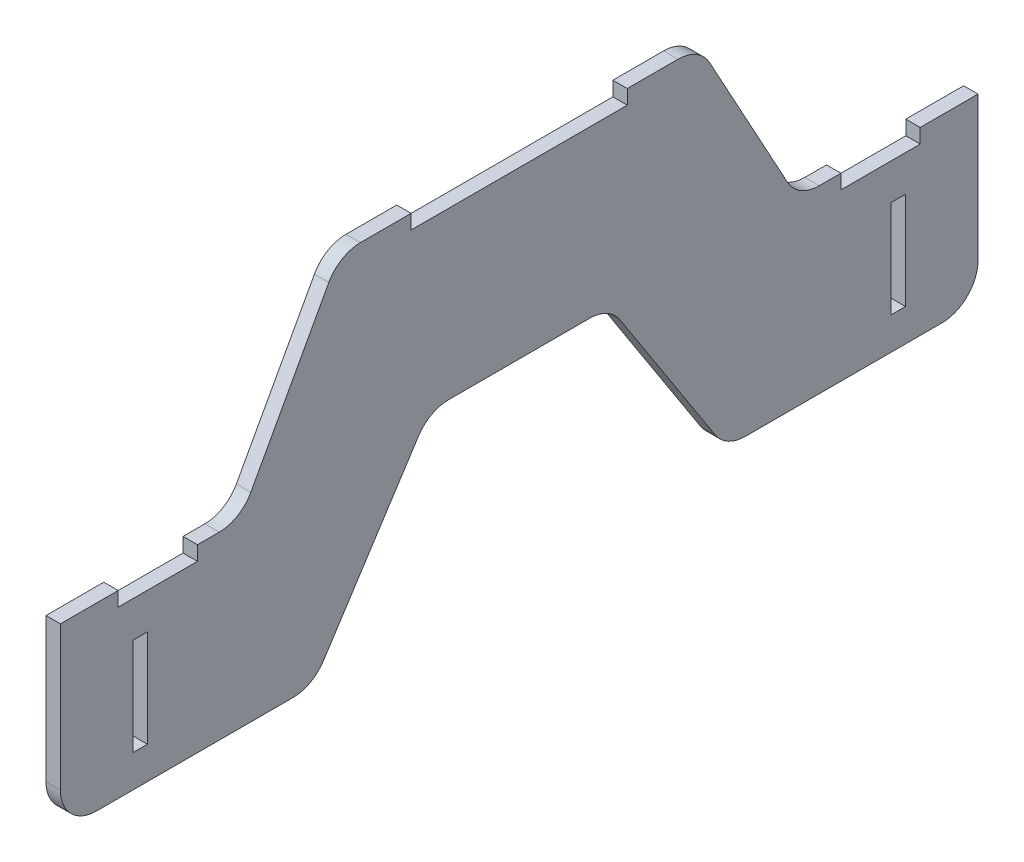
from build123d import *

# Parameters (mm, degrees)
SKETCH2_W           = 4
SKETCH2_H           = 27
BOSS_EXTRUDE1_DEPTH = 4


with BuildPart() as part:
    # Sketch2 → Boss-Extrude1 (new body)
    with BuildSketch(Plane(origin=(0, 0, 0), x_dir=(0, 0, -1), z_dir=(1, 0, 0))):
        with BuildLine():
            Line((10, -139.70232204), (64.557762355, -139.70232204))
            ThreePointArc((64.557762355, -139.70232204), (69.3379498, -138.485818382), (72.955114142, -135.132283638))
            Line((72.955114142, -135.132283638), (99.376278754, -94.272360441))
            ThreePointArc((99.376278754, -94.272360441), (102.993443097, -90.918825697), (107.773630541, -89.70232204))
            Line((107.773630541, -89.70232204), (146.889155251, -89.70232204))
            ThreePointArc((146.889155251, -89.70232204), (151.669342696, -90.918825697), (155.286507039, -94.272360441))
            Line((155.286507039, -94.272360441), (181.70767165, -135.132283638))
            ThreePointArc((181.70767165, -135.132283638), (185.324835993, -138.485818382), (190.105023438, -139.70232204))
            Line((190.105023438, -139.70232204), (244.662785793, -139.70232204))
            ThreePointArc((244.662785793, -139.70232204), (251.733853605, -136.773389851), (254.662785793, -129.70232204))
            Line((254.662785793, -129.70232204), (254.662785793, -100.70232204))
            Line((254.662785793, -100.70232204), (254.662785793, -89.70232204))
            Line((254.662785793, -89.70232204), (244.662785793, -89.70232204))
            Line((244.662785793, -89.70232204), (238.627896267, -89.70232204))
            Line((238.627896267, -89.70232204), (238.627896267, -93.70232204))
            Line((238.627896267, -93.70232204), (216.627896267, -93.70232204))
            Line((216.627896267, -93.70232204), (216.627896267, -89.70232204))
            Line((216.627896267, -89.70232204), (210.593006742, -89.70232204))
            ThreePointArc((210.593006742, -89.70232204), (205.492248957, -88.303616711), (201.818382591, -84.498776043))
            Line((201.818382591, -84.498776043), (180.175796098, -44.905868036))
            ThreePointArc((180.175796098, -44.905868036), (176.501929732, -41.101027368), (171.401171947, -39.70232204))
            Line((171.401171947, -39.70232204), (157.331392896, -39.70232204))
            Line((157.331392896, -39.70232204), (157.331392896, -43.70232204))
            Line((157.331392896, -43.70232204), (97.331392896, -43.70232204))
            Line((97.331392896, -43.70232204), (97.331392896, -39.70232204))
            Line((97.331392896, -39.70232204), (83.261613846, -39.70232204))
            ThreePointArc((83.261613846, -39.70232204), (78.160856061, -41.101027368), (74.486989695, -44.905868036))
            Line((74.486989695, -44.905868036), (52.844403202, -84.498776043))
            ThreePointArc((52.844403202, -84.498776043), (49.170536836, -88.303616711), (44.069779051, -89.70232204))
            Line((44.069779051, -89.70232204), (38.034889525, -89.70232204))
            Line((38.034889525, -89.70232204), (38.034889525, -93.70232204))
            Line((38.034889525, -93.70232204), (16.034889525, -93.70232204))
            Line((16.034889525, -93.70232204), (16.034889525, -89.70232204))
            Line((16.034889525, -89.70232204), (10, -89.70232204))
            Line((10, -89.70232204), (0, -89.70232204))
            Line((0, -89.70232204), (0, -100.70232204))
            Line((0, -100.70232204), (0, -129.70232204))
            ThreePointArc((0, -129.70232204), (2.928932188, -136.773389851), (10, -139.70232204))
        make_face()
        with Locations((232.532785793, -117.20232204)):
            Rectangle(SKETCH2_W, SKETCH2_H, mode=Mode.SUBTRACT)
        with Locations((22.13, -117.20232204)):
            Rectangle(SKETCH2_W, SKETCH2_H, mode=Mode.SUBTRACT)
    extrude(amount=BOSS_EXTRUDE1_DEPTH)


solid = part.part
